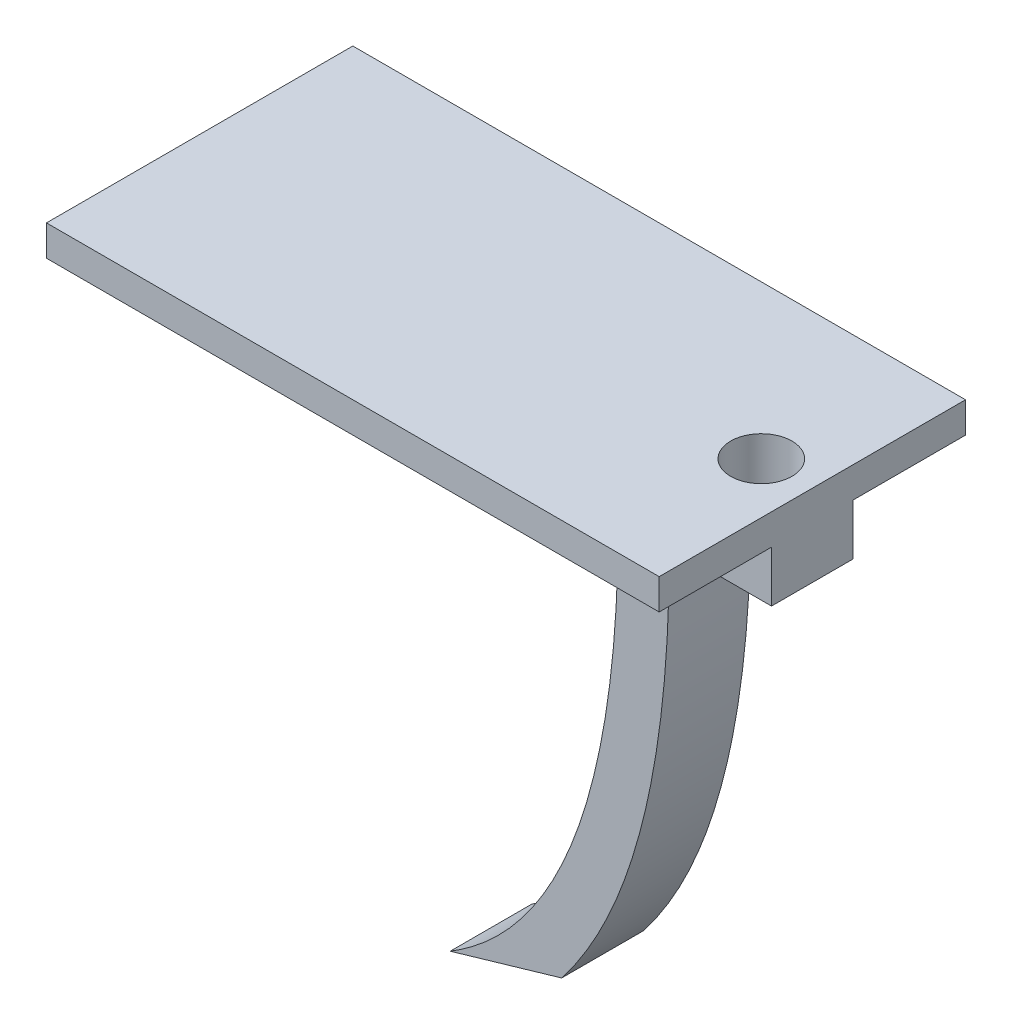
from build123d import *

# Parameters (mm, degrees)
BOSS_EXTRUDE1_DEPTH = 8
SKETCH4_W           = 60
SKETCH4_H           = 30
BOSS_EXTRUDE2_DEPTH = 3
SKETCH5_R           = 3
CUT_EXTRUDE1_DEPTH  = 68.388900825
CUT_EXTRUDE3_DEPTH  = 61.736204501


# Read off the part's stored shape, not the designer's step: Boss-Extrude1
with BuildPart() as part:
    # Boss-Extrude1 outline → Boss-Extrude1 (new body)
    with BuildSketch(Plane.XY):
        with BuildLine():
            Line((-30, 0), (15, 0))
            add(Edge.make_bspline(
                [(15, 0), (15, -35), (-1.465594932, -45)],
                knots=[0, 0, 0, 1, 1, 1], degree=2))
            Line((-1.465594932, -45), (1.12987064, -49.273588476))
            add(Edge.make_bspline(
                [(20, 0), (20, -0.746108231), (19.988920633, -2.249243802), (19.922237871, -5.16766696), (19.754979798, -8.712103145), (19.418395555, -12.782160754), (18.785639236, -17.973362747), (17.643635897, -24.021456658), (15.683824621, -30.584336804), (13.095918314, -36.449845939), (8.74916419, -43.310162254), (4.437502248, -47.26477457), (1.12987064, -49.273588476)],
                knots=[0, 0, 0, 0, 0.03125, 0.0625, 0.125, 0.1875, 0.25, 0.375, 0.5, 0.625, 0.75, 1, 1, 1, 1], degree=3))
            Line((20, 0), (30, 0))
            Line((30, 0), (30, 5))
            Line((30, 5), (-30, 5))
            Line((-30, 5), (-30, 0))
        make_face()
    extrude(amount=BOSS_EXTRUDE1_DEPTH)

    # Sketch4 → Boss-Extrude2 (add)
    with BuildSketch(Plane(origin=(0, 5, 0), x_dir=(1, 0, 0), z_dir=(0, 1, 0))):
        with Locations((0, -4)):
            Rectangle(SKETCH4_W, SKETCH4_H)
    extrude(amount=BOSS_EXTRUDE2_DEPTH)

    # Sketch5 → Cut-Extrude1 (cut, through all)
    with BuildSketch(Plane(origin=(0, 8, 0), x_dir=(1, 0, 0), z_dir=(0, 1, 0))):
        with Locations(Location((25, -4, 0), (0, 0, 180))):
            Circle(SKETCH5_R)
    extrude(amount=-CUT_EXTRUDE1_DEPTH, mode=Mode.SUBTRACT)

    # Sketch7 → Cut-Extrude3 (cut, through all)
    with BuildSketch(Plane.XY.offset(8)):
        Polygon((-1.465594932, -45), (9.447885747, -41.814579425), (11.582932476, -49.129403534), (0.669451797, -52.314824109), align=None)
    extrude(amount=-CUT_EXTRUDE3_DEPTH, mode=Mode.SUBTRACT)


solid = part.part
